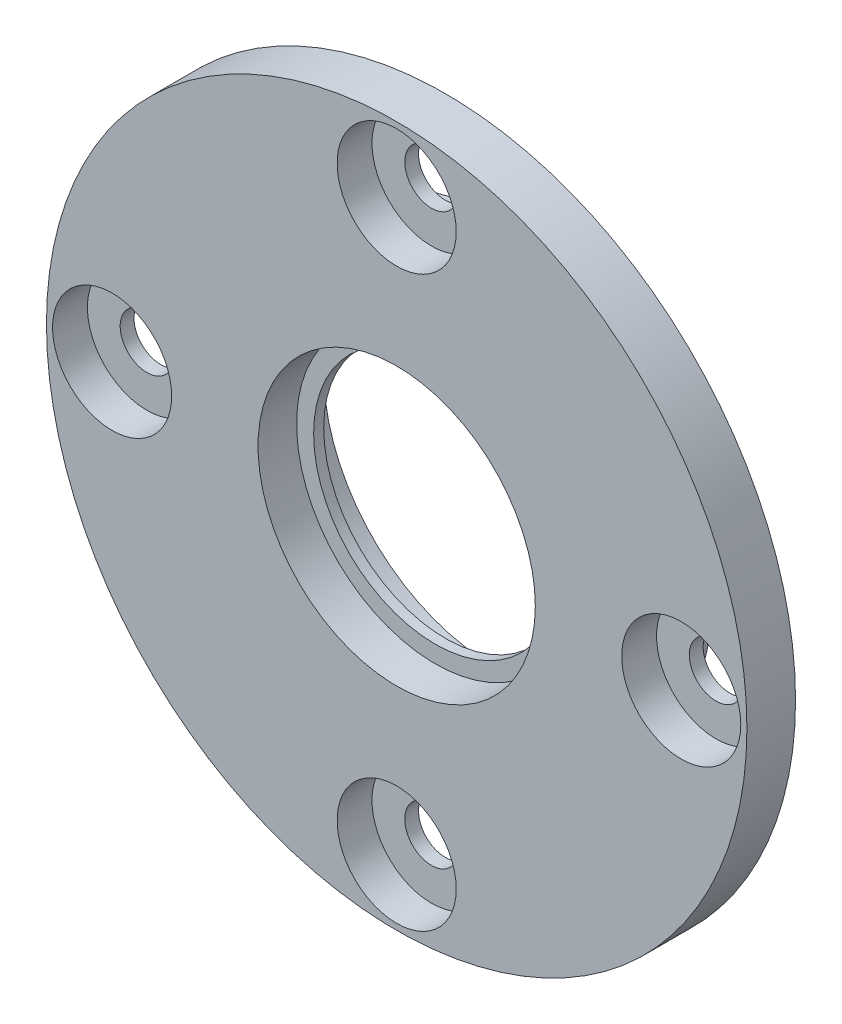
from build123d import *

# Parameters (mm, degrees)
SKETCH2_R                               = 12.5
SHAFT_THRU_DEPTH                        = 52.15662225
CBORE_FOR_M5_HEX_HEAD_BOLT1_D           = 5.5
CBORE_FOR_M5_HEX_HEAD_BOLT1_CBORE_D     = 12.24
CBORE_FOR_M5_HEX_HEAD_BOLT1_CBORE_DEPTH = 3.58
CIRPATTERN1_COUNT                       = 4
SKETCH5_R                               = 14.25
SEAL_SEAT_DEPTH                         = 3.9624


with BuildPart() as part:
    # Sketch1 → Main_body (revolve)
    with BuildSketch(Plane(origin=(0, 0, 0), x_dir=(0, 0, -1), z_dir=(1, 0, 0))):
        Polygon((-136.5, 9.5), (-131.5, 9.5), (-131.5, 17.5), (-126.5, 17.5), (-126.5, 22.5), (-131.5, 22.5), (-131.5, 36), (-136.5, 36), align=None)
    revolve(axis=Axis((0, 0, 1000), (0, 0, -1)))

    # Sketch2 → Shaft_thru (cut, through all)
    with BuildSketch(Plane(origin=(0, 0, 131.5), x_dir=(-1, 0, 0), z_dir=(0, 0, -1))):
        Circle(SKETCH2_R)
    extrude(amount=-SHAFT_THRU_DEPTH, mode=Mode.SUBTRACT)

    # CBORE for M5 Hex Head Bolt1 (through all)
    with Locations(Plane.XY.offset(136.5)):
        with Locations((0, 29.25)):
            cbore_for_m5_hex_head_bolt1 = CounterBoreHole(CBORE_FOR_M5_HEX_HEAD_BOLT1_D / 2, CBORE_FOR_M5_HEX_HEAD_BOLT1_CBORE_D / 2, CBORE_FOR_M5_HEX_HEAD_BOLT1_CBORE_DEPTH)

    # CirPattern1: CBORE for M5 Hex Head Bolt1 ×4 about axis
    cirpattern1_axis = Axis((0, 0, 1000), (0, 0, -1))
    for i in range(1, CIRPATTERN1_COUNT):
        add(cbore_for_m5_hex_head_bolt1.rotate(cirpattern1_axis, i * 360 / CIRPATTERN1_COUNT), mode=Mode.SUBTRACT)

    # Sketch5 → seal_seat (cut)
    with BuildSketch(Plane.XY.offset(136.5)):
        Circle(SKETCH5_R)
    extrude(amount=-SEAL_SEAT_DEPTH, mode=Mode.SUBTRACT)


solid = part.part
